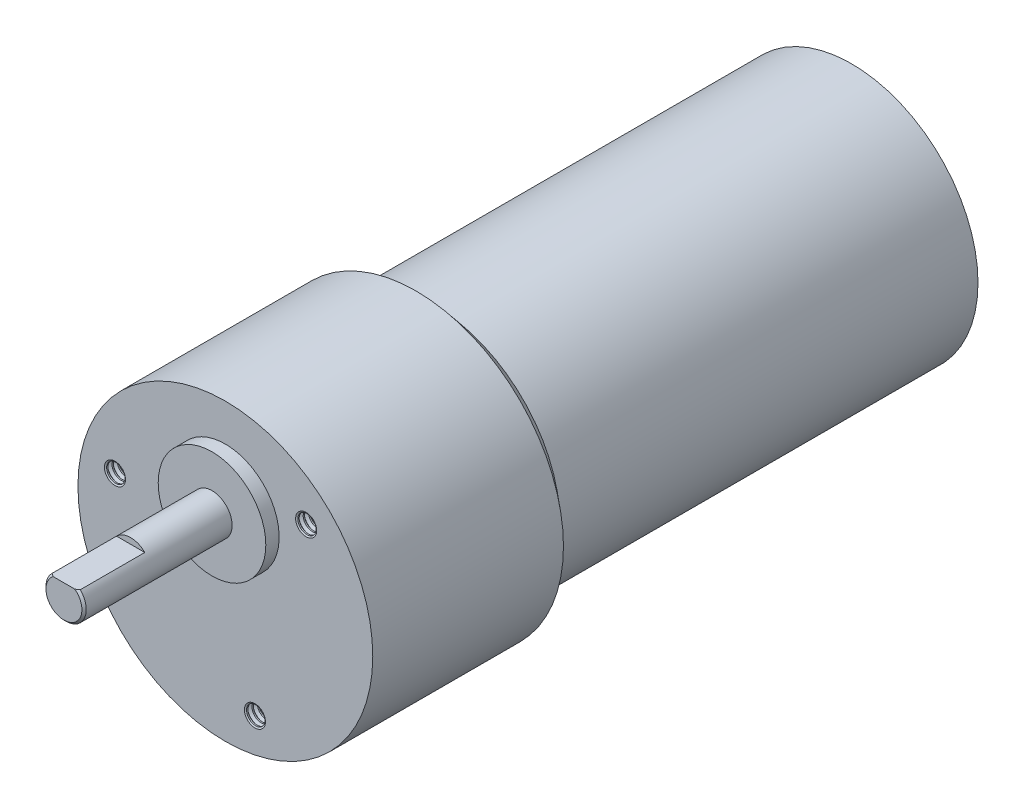
from build123d import *

# Parameters (mm, degrees)
SKETCH1_R          = 6.35
EXTRUDE1_DEPTH     = 1.5748
SKETCH2_R          = 14.9225
EXTRUDE2_DEPTH     = 73.914
SKETCH3_R          = 2.3749
EXTRUDE3_DEPTH     = 19.05
CIRPATTERN1_COUNT  = 3
SKETCH14_W         = 3.33891671
SKETCH14_H         = 0.6858
CUT_EXTRUDE3_DEPTH = 7.874
CHAMFER1_SIZE      = 0.254


with BuildPart() as part:
    # Sketch1 → Extrude1 (new body)
    with BuildSketch(Plane.XY):
        with Locations((0, 6.6548)):
            Circle(SKETCH1_R)
    extrude(amount=EXTRUDE1_DEPTH)

    # Sketch2 → Extrude2 (add)
    with BuildSketch(Plane(origin=(0, 0, 0), x_dir=(-1, 0, 0), z_dir=(0, 0, -1))):
        Circle(SKETCH2_R)
    extrude(amount=EXTRUDE2_DEPTH)

    # Sketch3 → Extrude3 (add)
    with BuildSketch(Plane.XY):
        with Locations((0, 6.6548)):
            Circle(SKETCH3_R)
    extrude(amount=EXTRUDE3_DEPTH)

    # Sketch9 → Revolve1 (revolve)
    with BuildSketch(Plane(origin=(0, 0, 0), x_dir=(0, 0, -1), z_dir=(1, 0, 0))):
        Polygon((73.914, 0), (73.914, 6.35), (75.4888, 6.35), (75.4888, 1.9812), (76.7588, 1.9812), (76.7588, 0), align=None)
    revolve(axis=Axis((0, 0, -51.186992867), (0, 0, -1)))

    # Sketch13 → Revolve3 (revolve)
    with BuildSketch(Plane(origin=(0, 0, 0), x_dir=(0, 0, -1), z_dir=(1, 0, 0))):
        Polygon((0, 14.9225), (0, 17.399), (22.509169763, 17.399), (24.5872, 14.9225), align=None)
    revolve(axis=Axis((0, 0, 4.819894785), (0, 0, -1)))

    # Sketch7 → Cut-Revolve1 (revolve, cut)
    with BuildSketch(Plane(origin=(0, 0, 0), x_dir=(0, 0, -1), z_dir=(-0.9659258262890681, -0.2588190451025213, 0))):
        Polygon((-0.381, 13.4874), (5.334, 13.4874), (5.334, 14.566096168), (5.17525, 14.566096168), (4.9768125, 14.9098), (4.8974375, 14.9098), (4.699, 14.566096168), (4.54025, 14.566096168), (4.3418125, 14.9098), (4.2624375, 14.9098), (4.064, 14.566096168), (3.90525, 14.566096168), (3.7068125, 14.9098), (3.6274375, 14.9098), (3.429, 14.566096168), (3.27025, 14.566096168), (3.0718125, 14.9098), (2.9924375, 14.9098), (2.794, 14.566096168), (2.63525, 14.566096168), (2.4368125, 14.9098), (2.3574375, 14.9098), (2.159, 14.566096168), (2.00025, 14.566096168), (1.8018125, 14.9098), (1.7224375, 14.9098), (1.524, 14.566096168), (1.36525, 14.566096168), (1.1668125, 14.9098), (1.0874375, 14.9098), (0.889, 14.566096168), (0.73025, 14.566096168), (0.5318125, 14.9098), (0.4524375, 14.9098), (0.254, 14.566096168), (0.09525, 14.566096168), (-0.1031875, 14.9098), (-0.1825625, 14.9098), (-0.381, 14.566096168), align=None)
    cut_revolve1 = revolve(axis=Axis((3.490795989, -13.027827989, 0.218691166), (0, 0, -1)), mode=Mode.SUBTRACT)

    # CirPattern1: Cut-Revolve1 ×3 about axis
    cirpattern1_axis = Axis((0, 0, -73.914), (0, 0, 1))
    for i in range(1, CIRPATTERN1_COUNT):
        add(cut_revolve1.rotate(cirpattern1_axis, i * 360 / CIRPATTERN1_COUNT), mode=Mode.SUBTRACT)

    # Sketch14 → Cut-Extrude3 (cut)
    with BuildSketch(Plane.XY.offset(19.05)):
        with Locations((0, 8.6868)):
            Rectangle(SKETCH14_W, SKETCH14_H)
    extrude(amount=-CUT_EXTRUDE3_DEPTH, mode=Mode.SUBTRACT)

    # Chamfer1
    chamfer1_edges = [part.edges().sort_by_distance(p)[0] for p in [
        (-0.915246787, 4.463345385, 19.05),
        (0, -1.9812, -76.7588),
    ]]
    chamfer(chamfer1_edges, length=CHAMFER1_SIZE)


solid = part.part
